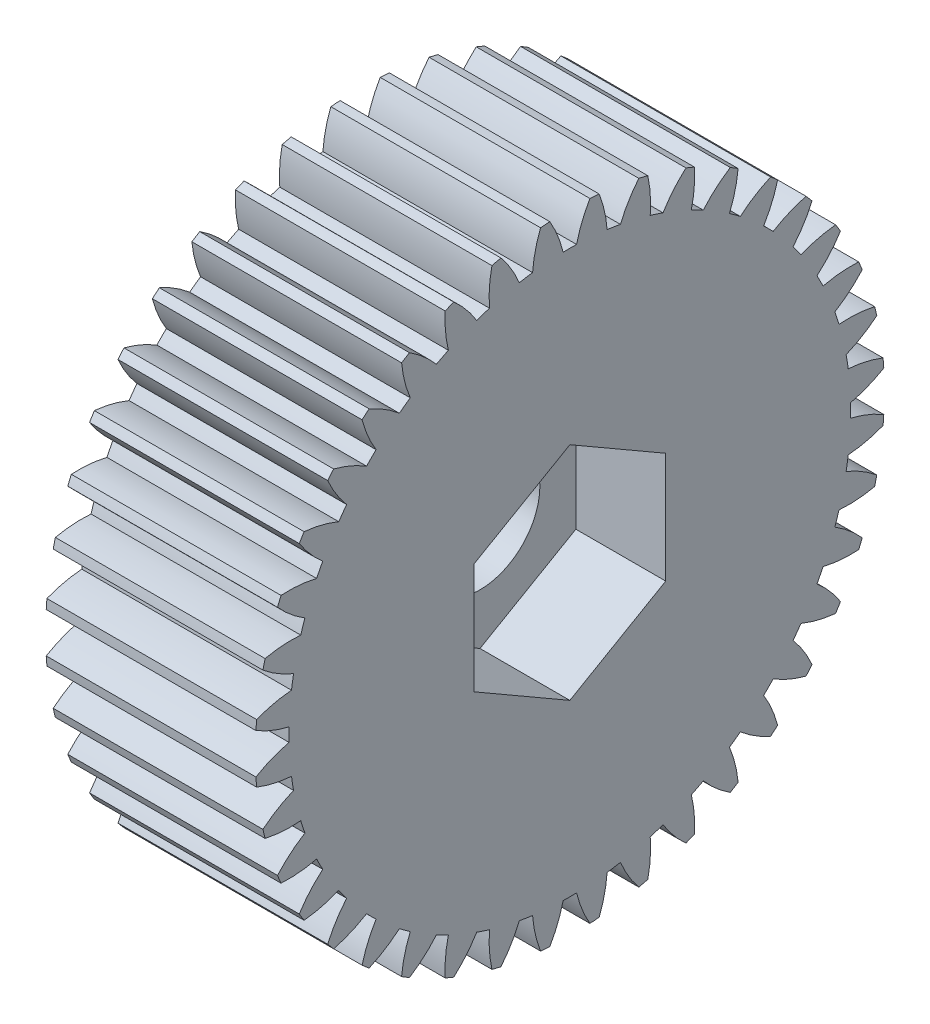
from build123d import *
from build123d.topology import SkipClean

# Parameters (mm, degrees)
BASPROSKE_W         = 14
BASPROSKE_H         = 21
TOOTHCUT_DEPTH      = 33.832910319
TEETHCUTS_COUNT     = 40
TEETHCUTS_ANGLE     = 351
BORSKE_R            = 2
BORE_DEPTH          = 50.0000508
CUT_EXTRUDE1_DEPTH  = 6
SKETCH1_7_R         = 4
CUT_EXTRUDE2_DEPTH  = 33.77815655
SKETCH2_R           = 6.5
SKETCH2_R_2         = 4
BOSS_EXTRUDE1_DEPTH = 3.8


with BuildPart() as part:
    # BasProSke → Base-Revolve (revolve)
    with BuildSketch(Plane(origin=(0, 0, 0), x_dir=(1, 0, 0), z_dir=(0, 1, 0))):
        with Locations((7, 10.5)):
            Rectangle(BASPROSKE_W, BASPROSKE_H)
    revolve(axis=Axis((-10, 0, 0), (1, 0, 0)))

    # TooCutSke → ToothCut (cut, through all)
    with BuildSketch(Plane(origin=(0, 0, 0), x_dir=(0, 0, -1), z_dir=(1, 0, 0))):
        with BuildLine():
            ThreePointArc((0.448673268, 18.74363074), (0, 18.749), (-0.448673268, 18.74363074))
            ThreePointArc((-0.448673268, 18.74363074), (-0.816786816, 19.89705013), (-1.354745081, 20.981708961))
            ThreePointArc((-1.354745081, 20.981708961), (0, 21.0254), (1.354745081, 20.981708961))
            ThreePointArc((1.354745081, 20.981708961), (0.816786816, 19.89705013), (0.448673268, 18.74363074))
        make_face()
    toothcut = extrude(amount=TOOTHCUT_DEPTH, mode=Mode.SUBTRACT)

    # TeethCuts: ToothCut ×40 about axis
    teethcuts_axis = Axis((-10, 0, 0), (1, 0, 0))
    for i in range(1, TEETHCUTS_COUNT):
        add(toothcut.rotate(teethcuts_axis, i * TEETHCUTS_ANGLE / (TEETHCUTS_COUNT - 1)), mode=Mode.SUBTRACT)

    # BorSke → Bore (cut, symmetric)
    with BuildSketch(Plane(origin=(0, 0, 0), x_dir=(0, 0, -1), z_dir=(1, 0, 0))):
        Circle(BORSKE_R)
    extrude(amount=BORE_DEPTH, both=True, mode=Mode.SUBTRACT)

    # Sketch1 → Cut-Extrude1 (cut)
    with BuildSketch(Plane(origin=(14, 0, 0), x_dir=(0, 0, -1), z_dir=(1, 0, 0))):
        Polygon((0, 7.390083446), (-6.4, 3.695041723), (-6.4, -3.695041723), (0, -7.390083446), (6.4, -3.695041723), (6.4, 3.695041723), align=None)
    extrude(amount=-CUT_EXTRUDE1_DEPTH, mode=Mode.SUBTRACT)

    # Sketch1<7> → Cut-Extrude2 (cut, through all)
    with BuildSketch(Plane(origin=(14, 0, 0), x_dir=(0, 0, -1), z_dir=(1, 0, 0))):
        Circle(SKETCH1_7_R)
    extrude(amount=-CUT_EXTRUDE2_DEPTH, mode=Mode.SUBTRACT)

    # Sketch2 → Boss-Extrude1 (add)
    with SkipClean():  # the faces are left unmerged after this step: merging them gives an invalid solid
        with BuildSketch(Plane.ZY):
            Circle(SKETCH2_R)
            Circle(SKETCH2_R_2, mode=Mode.SUBTRACT)
        extrude(amount=BOSS_EXTRUDE1_DEPTH)


solid = part.part
